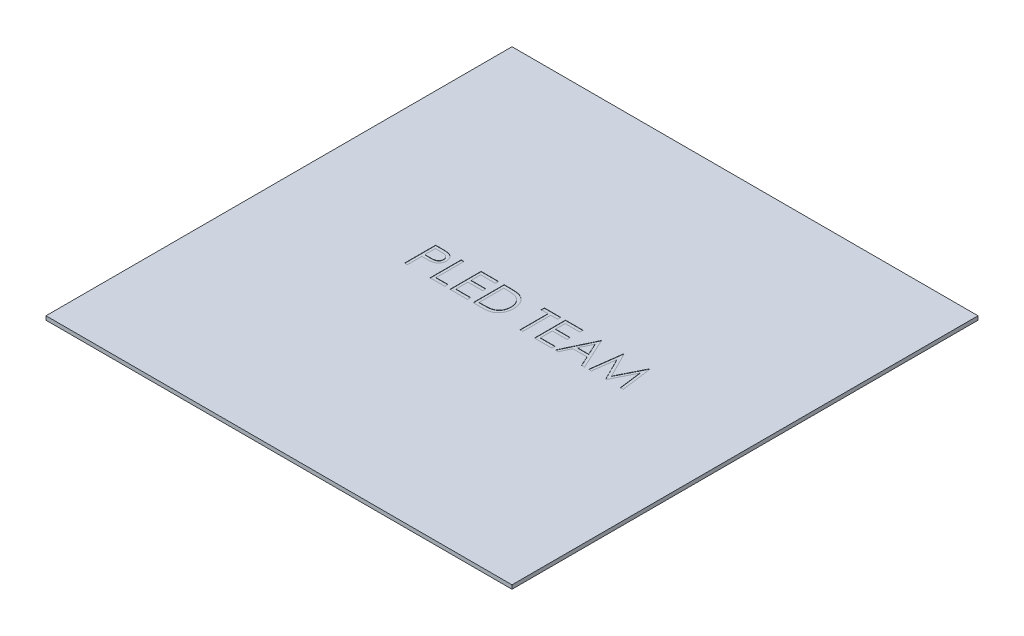
from build123d import *

# Parameters (mm, degrees)
SKETCH1_W           = 381
SKETCH1_H           = 381
BOSS_EXTRUDE1_DEPTH = 3.175
CUT_EXTRUDE1_DEPTH  = 0.254


with BuildPart() as part:
    # Sketch1 → Boss-Extrude1 (new body)
    with BuildSketch(Plane(origin=(0, 0, 0), x_dir=(1, 0, 0), z_dir=(0, 1, 0))):
        Rectangle(SKETCH1_W, SKETCH1_H)
    extrude(amount=BOSS_EXTRUDE1_DEPTH)

    # Sketch3 → Cut-Extrude1 (cut)
    # profile 1 of 8: a face of its own
    with BuildSketch(Plane(origin=(0, 3.175, 0), x_dir=(1, 0, 0), z_dir=(0, 1, 0))):
        with BuildLine():
            Line((-81.199118404, 18.794440271), (-76.217828339, 18.794440271))
            add(Edge.make_bspline(
                [(-76.217828339, 18.794440271), (-75.875212049, 18.794063653), (-75.218744021, 18.793342035), (-74.277383331, 18.771463594), (-73.422421279, 18.742241314), (-72.655701372, 18.701732718), (-71.974864545, 18.65386032), (-71.382991572, 18.586716949), (-70.87543022, 18.516610804), (-70.57130913, 18.445335454), (-70.432611993, 18.412829694)],
                knots=[0, 0, 0, 0, 1.415646017, 2.712440637, 3.8905458, 4.950247383, 5.884950622, 6.709939814, 7.411656543, 8, 8, 8, 8], degree=3))
            add(Edge.make_bspline(
                [(-70.432611993, 18.412829694), (-70.257036062, 18.364773259), (-69.910021428, 18.269792777), (-69.409996715, 18.07955604), (-68.934263093, 17.853988327), (-68.481188355, 17.596911735), (-68.056340095, 17.297296498), (-67.653379683, 16.967287958), (-67.275863255, 16.59926686), (-66.925913725, 16.19736092), (-66.604532623, 15.768317111), (-66.327820068, 15.305730642), (-66.096119621, 14.81738804), (-65.897395308, 14.303628981), (-65.754368238, 13.760139205), (-65.646622166, 13.190695064), (-65.578233554, 12.595357598), (-65.571683534, 12.188523131), (-65.568349173, 11.981419438)],
                knots=[0, 0, 0, 0, 0.999701418, 1.975846123, 2.934577507, 3.890451536, 4.834027766, 5.787354733, 6.749476667, 7.726910423, 8.712836071, 9.690891519, 10.682875813, 11.679750201, 12.712814741, 13.765529915, 14.8625177, 16, 16, 16, 16], degree=3))
            add(Edge.make_bspline(
                [(-65.568349173, 11.981419438), (-65.571407512, 11.772575001), (-65.57739136, 11.363956754), (-65.649210116, 10.766165662), (-65.745949221, 10.19489506), (-65.894699258, 9.651411619), (-66.089522143, 9.138942885), (-66.318064469, 8.649657373), (-66.593716375, 8.191879182), (-66.91045314, 7.763946386), (-67.262798996, 7.365457308), (-67.649263176, 6.999299657), (-68.06828547, 6.667616744), (-68.518534202, 6.369664993), (-69.004398819, 6.112353707), (-69.518510448, 5.881886408), (-70.065337733, 5.688330711), (-70.443743405, 5.586512551), (-70.636137634, 5.534744759)],
                knots=[0, 0, 0, 0, 1.121902311, 2.195077645, 3.232258892, 4.234102512, 5.217864754, 6.176164875, 7.132989551, 8.084763148, 9.034132444, 9.988522005, 10.94243251, 11.903244335, 12.886203696, 13.894208494, 14.929344452, 16, 16, 16, 16], degree=3))
            add(Edge.make_bspline(
                [(-70.636137634, 5.534744759), (-70.79526743, 5.500904839), (-71.144009628, 5.426742687), (-71.718359669, 5.343949886), (-72.387071898, 5.273282727), (-73.149233587, 5.220297328), (-74.004160611, 5.174937511), (-74.95231545, 5.138883344), (-75.995559325, 5.119072405), (-76.723242067, 5.118050651), (-77.103164878, 5.117517194)],
                knots=[0, 0, 0, 0, 0.601384939, 1.31797006, 2.144135048, 3.087295005, 4.142315834, 5.309527816, 6.595305764, 8, 8, 8, 8], degree=3))
            Line((-77.103164878, 5.117517194), (-78.919631224, 5.117517194))
            Line((-78.919631224, 5.117517194), (-78.919631224, -6.605559729))
            Line((-78.919631224, -6.605559729), (-81.199118404, -6.605559729))
            Line((-81.199118404, -6.605559729), (-81.199118404, 18.794440271))
        make_face()
        with BuildLine():
            Line((-78.919631224, 16.189312066), (-78.919631224, 7.7226454))
            Line((-78.919631224, 7.7226454), (-74.472595968, 7.666675848))
            add(Edge.make_bspline(
                [(-74.472595968, 7.666675848), (-74.255462792, 7.666563627), (-73.836291672, 7.666346986), (-73.230783081, 7.695268322), (-72.669012824, 7.728655044), (-72.152706477, 7.777538603), (-71.681631296, 7.846635729), (-71.2550018, 7.916389484), (-70.87612609, 8.017302687), (-70.432720455, 8.153178675), (-69.938629876, 8.384918228), (-69.401111095, 8.721286002), (-68.945575983, 9.150043141), (-68.551380343, 9.632119403), (-68.238554829, 10.168415942), (-68.009548485, 10.742230511), (-67.874992657, 11.347678334), (-67.856949995, 11.761975113), (-67.847836352, 11.971243156)],
                knots=[0, 0, 0, 0, 1.160613943, 2.240541288, 3.23993089, 4.169200891, 5.011653406, 5.7853311, 6.478053781, 7.106038997, 8.262395093, 9.384106736, 10.481365981, 11.59014053, 12.70357646, 13.786202915, 14.881775077, 16, 16, 16, 16], degree=3))
            add(Edge.make_bspline(
                [(-67.847836352, 11.971243156), (-67.856999558, 12.175448368), (-67.875214878, 12.581383056), (-68.010603142, 13.176314633), (-68.238109591, 13.744082316), (-68.553480305, 14.273658421), (-68.93623022, 14.754000027), (-69.38108831, 15.171264892), (-69.887007407, 15.506702392), (-70.357620283, 15.723206778), (-70.775640319, 15.855397634), (-71.138729399, 15.947888762), (-71.548690294, 16.021734591), (-72.005656465, 16.081529839), (-72.50608606, 16.132717815), (-73.054278402, 16.167450336), (-73.648156842, 16.187780904), (-74.06043927, 16.188789322), (-74.274158468, 16.189312066)],
                knots=[0, 0, 0, 0, 1.120700087, 2.227813068, 3.331159281, 4.466773991, 5.599788987, 6.693661531, 7.80175334, 8.91857717, 9.525282508, 10.207424825, 10.974604443, 11.810962634, 12.737642355, 13.736264703, 14.826523623, 16, 16, 16, 16], degree=3))
            Line((-74.274158468, 16.189312066), (-78.919631224, 16.189312066))
        make_face(mode=Mode.SUBTRACT)
    # profile 2 of 8: a face of its own
    with BuildSketch(Plane(origin=(0, 3.175, 0), x_dir=(1, 0, 0), z_dir=(0, 1, 0))):
        Polygon((-60.358092763, 18.794440271), (-58.078605583, 18.794440271), (-58.078605583, -4.000431523), (-48.309374814, -4.000431523), (-48.309374814, -6.605559729), (-60.358092763, -6.605559729), align=None)
    # profile 3 of 8: a face of its own
    with BuildSketch(Plane(origin=(0, 3.175, 0), x_dir=(1, 0, 0), z_dir=(0, 1, 0))):
        Polygon((-44.07604148, 18.794440271), (-29.747836352, 18.794440271), (-29.747836352, 16.189312066), (-41.796554301, 16.189312066), (-41.796554301, 8.373927451), (-29.747836352, 8.373927451), (-29.747836352, 5.768799246), (-41.796554301, 5.768799246), (-41.796554301, -4.000431523), (-29.747836352, -4.000431523), (-29.747836352, -6.605559729), (-44.07604148, -6.605559729), align=None)
    # profile 4 of 8: a face of its own
    with BuildSketch(Plane(origin=(0, 3.175, 0), x_dir=(1, 0, 0), z_dir=(0, 1, 0))):
        with BuildLine():
            Line((-25.188861993, -6.605559729), (-25.188861993, 18.794440271))
            Line((-25.188861993, 18.794440271), (-20.060015839, 18.794440271))
            add(Edge.make_bspline(
                [(-20.060015839, 18.794440271), (-19.613926611, 18.791228478), (-18.752084542, 18.785023309), (-17.506668495, 18.745679499), (-16.354352048, 18.676080118), (-15.298925013, 18.574701272), (-14.337489932, 18.450219256), (-13.47273889, 18.29418775), (-12.700200482, 18.109942171), (-12.225079399, 17.952858046), (-12.000400455, 17.878574887)],
                knots=[0, 0, 0, 0, 1.314313732, 2.53924729, 3.670748893, 4.714932338, 5.66265055, 6.526160246, 7.303039223, 8, 8, 8, 8], degree=3))
            add(Edge.make_bspline(
                [(-12.000400455, 17.878574887), (-11.706524347, 17.766592052), (-11.125436266, 17.54516578), (-10.29807029, 17.127471479), (-9.519194799, 16.654210684), (-8.784633005, 16.124759566), (-8.11116415, 15.524126865), (-7.472478271, 14.877826873), (-6.894702847, 14.162357204), (-6.365596927, 13.392555862), (-5.888543856, 12.577491255), (-5.473876825, 11.718716466), (-5.129496416, 10.820592727), (-4.843614143, 9.885617653), (-4.618305565, 8.911735369), (-4.464585261, 7.897811884), (-4.363195791, 6.847854338), (-4.353006391, 6.135388229), (-4.347836352, 5.773887387)],
                knots=[0, 0, 0, 0, 0.984719456, 1.947108742, 2.898477687, 3.838006223, 4.779231079, 5.722358779, 6.681677486, 7.655904652, 8.64651281, 9.637519902, 10.640069247, 11.656948941, 12.698408672, 13.768548281, 14.867775369, 16, 16, 16, 16], degree=3))
            add(Edge.make_bspline(
                [(-4.347836352, 5.773887387), (-4.352400859, 5.459934399), (-4.361395697, 4.841257245), (-4.442162732, 3.929463317), (-4.559556597, 3.044719113), (-4.741305919, 2.191237747), (-4.961941302, 1.361541537), (-5.244709714, 0.56447325), (-5.568635886, -0.207278966), (-5.946369291, -0.943280077), (-6.361052485, -1.640570837), (-6.806073136, -2.297890383), (-7.280956582, -2.905859136), (-7.790231175, -3.466318206), (-8.327315746, -3.978422689), (-8.895726602, -4.446450458), (-9.496930456, -4.861243742), (-10.128234559, -5.239102184), (-10.808055611, -5.568724193), (-11.549270182, -5.847616264), (-12.355039303, -6.078731701), (-13.223385161, -6.271560488), (-14.155808114, -6.424521484), (-15.153222323, -6.527038732), (-16.21409534, -6.596365729), (-16.942562008, -6.602435556), (-17.317507827, -6.605559729)],
                knots=[0, 0, 0, 0, 1.105936401, 2.179363191, 3.223086493, 4.248585256, 5.251745608, 6.245858792, 7.225916811, 8.198733463, 9.158002045, 10.082870192, 10.993790845, 11.873723703, 12.748670949, 13.606408763, 14.465103618, 15.319838547, 16.196477973, 17.123216899, 18.106603292, 19.147568657, 20.255746949, 21.433717677, 22.679120308, 24, 24, 24, 24], degree=3))
            Line((-17.317507827, -6.605559729), (-25.188861993, -6.605559729))
        make_face()
        with BuildLine():
            Line((-22.909374814, -4.000431523), (-19.993870006, -4.000431523))
            add(Edge.make_bspline(
                [(-19.993870006, -4.000431523), (-19.574926973, -3.998631053), (-18.769146093, -3.995168088), (-17.610485198, -3.964780957), (-16.551817578, -3.915128039), (-15.59299291, -3.845640331), (-14.734552562, -3.753702381), (-13.974702492, -3.651195944), (-13.315933474, -3.52348873), (-12.917302703, -3.407730339), (-12.733092763, -3.354237613)],
                knots=[0, 0, 0, 0, 1.375205317, 2.645023457, 3.804390687, 4.853969522, 5.800190428, 6.637939096, 7.370582563, 8, 8, 8, 8], degree=3))
            add(Edge.make_bspline(
                [(-12.733092763, -3.354237613), (-12.501238935, -3.272583448), (-12.043069103, -3.111225425), (-11.383532085, -2.816892683), (-10.768438394, -2.46824452), (-10.187068496, -2.080696589), (-9.64766934, -1.640579889), (-9.14384861, -1.157464713), (-8.67662068, -0.628892345), (-8.250812845, -0.05551883), (-7.869752582, 0.559087116), (-7.539761374, 1.208883223), (-7.250553116, 1.886749789), (-7.023559901, 2.603096254), (-6.845646804, 3.351518564), (-6.719628783, 4.132069369), (-6.641144783, 4.9446029), (-6.631990275, 5.497249745), (-6.627323532, 5.778975528)],
                knots=[0, 0, 0, 0, 0.998632004, 1.973411704, 2.929992603, 3.868527914, 4.809262121, 5.754881198, 6.702106254, 7.672490631, 8.653608572, 9.636854334, 10.631411391, 11.644891563, 12.686317036, 13.754757253, 14.855430412, 16, 16, 16, 16], degree=3))
            add(Edge.make_bspline(
                [(-6.627323532, 5.778975528), (-6.631048531, 6.076035642), (-6.638366326, 6.659612866), (-6.730345608, 7.515888197), (-6.864759182, 8.339433489), (-7.059132218, 9.130303822), (-7.306824881, 9.890042149), (-7.615940282, 10.614446594), (-7.96912089, 11.311167643), (-8.389333677, 11.964124468), (-8.849549698, 12.581657318), (-9.360292022, 13.147387276), (-9.913446245, 13.662603055), (-10.502979152, 14.135328353), (-11.145505529, 14.546544744), (-11.825889457, 14.914385229), (-12.554112328, 15.226557698), (-13.060753035, 15.392592873), (-13.31822898, 15.476972323)],
                knots=[0, 0, 0, 0, 1.122418816, 2.205001699, 3.251619955, 4.274784885, 5.280384055, 6.268708349, 7.249350384, 8.229342522, 9.199999885, 10.157847722, 11.105861043, 12.055065948, 13.010012805, 13.98527497, 14.976112212, 16, 16, 16, 16], degree=3))
            add(Edge.make_bspline(
                [(-13.31822898, 15.476972323), (-13.531234443, 15.535874399), (-13.984142498, 15.661116375), (-14.723206037, 15.797734793), (-15.55498455, 15.918236014), (-16.483170952, 16.020257214), (-17.506707198, 16.093462346), (-18.626380477, 16.148408458), (-19.84267475, 16.185468019), (-20.685827996, 16.187998637), (-21.123437314, 16.189312066)],
                knots=[0, 0, 0, 0, 0.674548936, 1.434276114, 2.292660221, 3.240891867, 4.284742987, 5.42552168, 6.663806718, 8, 8, 8, 8], degree=3))
            Line((-21.123437314, 16.189312066), (-22.909374814, 16.189312066))
            Line((-22.909374814, 16.189312066), (-22.909374814, -4.000431523))
        make_face(mode=Mode.SUBTRACT)
    # profile 5 of 8: a face of its own
    with BuildSketch(Plane(origin=(0, 3.175, 0), x_dir=(1, 0, 0), z_dir=(0, 1, 0))):
        Polygon((7.700881596, 16.189312066), (7.700881596, 18.794440271), (21.052163648, 18.794440271), (21.052163648, 16.189312066), (15.516266212, 16.189312066), (15.516266212, -6.605559729), (13.236779032, -6.605559729), (13.236779032, 16.189312066), align=None)
    # profile 6 of 8: a face of its own
    with BuildSketch(Plane(origin=(0, 3.175, 0), x_dir=(1, 0, 0), z_dir=(0, 1, 0))):
        Polygon((24.959855955, 18.794440271), (39.288061084, 18.794440271), (39.288061084, 16.189312066), (27.239343135, 16.189312066), (27.239343135, 8.373927451), (39.288061084, 8.373927451), (39.288061084, 5.768799246), (27.239343135, 5.768799246), (27.239343135, -4.000431523), (39.288061084, -4.000431523), (39.288061084, -6.605559729), (24.959855955, -6.605559729), align=None)
    # profile 7 of 8: a face of its own
    with BuildSketch(Plane(origin=(0, 3.175, 0), x_dir=(1, 0, 0), z_dir=(0, 1, 0))):
        Polygon((54.267548263, 18.794440271), (65.990625186, -6.605559729), (63.512700507, -6.605559729), (59.75765243, 1.535465912), (48.243189289, 1.535465912), (44.38129025, -6.605559729), (41.893189289, -6.605559729), (53.941907237, 18.794440271), align=None)
        Polygon((54.079287045, 13.843679053), (49.479607558, 4.140594118), (58.556851148, 4.140594118), align=None, mode=Mode.SUBTRACT)
    # profile 8 of 8: a face of its own
    with BuildSketch(Plane(origin=(0, 3.175, 0), x_dir=(1, 0, 0), z_dir=(0, 1, 0))):
        Polygon((69.247035443, -6.605559729), (72.600120378, 18.794440271), (72.925761404, 18.794440271), (83.412420058, -2.04658537), (93.873638007, 18.794440271), (94.204367173, 18.794440271), (97.577804673, -6.605559729), (95.288141212, -6.605559729), (92.856009802, 11.671042836), (83.687179673, -6.605559729), (83.17327743, -6.605559729), (73.968830314, 11.711747964), (71.541787045, -6.605559729), align=None)
    extrude(amount=-CUT_EXTRUDE1_DEPTH, mode=Mode.SUBTRACT)


solid = part.part
